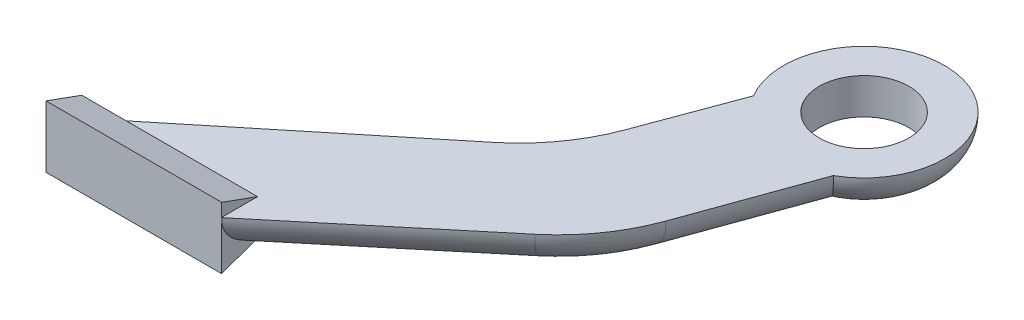
from build123d import *

# Parameters (mm, degrees)
SKETCH1_R                = 2.5
BOSS_EXTRUDE1_DEPTH      = 2
FILLET1_R                = 10
FILLET2_R                = 10
BOSS_EXTRUDE2_DEPTH      = 5.3
BOSS_EXTRUDE2_DEPTH_BACK = 4.5
FILLET7_R                = 2
FILLET8_R                = 2


with BuildPart() as part:
    # Sketch1 → Boss-Extrude1 (new body)
    with BuildSketch(Plane(origin=(0, 0, 0), x_dir=(1, 0, 0), z_dir=(0, 1, 0))):
        with BuildLine():
            Line((4.734439188, 4.337505525), (-11.123424173, -8.60036928))
            Line((-11.123424173, -8.60036928), (-1.31921636, -8.60036928))
            Line((-1.31921636, -8.60036928), (10.297086052, 1.061724594))
            Line((10.297086052, 1.061724594), (13.693514413, 10.480195617))
            ThreePointArc((13.693514413, 10.480195617), (12.643820806, 18.747230765), (7.611903427, 12.10452542))
            Line((7.611903427, 12.10452542), (4.734439188, 4.337505525))
        make_face()
        with Locations(Location((11.482625797, 14.39963072, 0), (0, 0, 270))):
            Circle(SKETCH1_R, mode=Mode.SUBTRACT)
    extrude(amount=BOSS_EXTRUDE1_DEPTH)

    # Fillet1
    fillet1_edges = [part.edges().sort_by_distance(p)[0] for p in [
        (10.297086052, 1, -1.061724594),
    ]]
    fillet(fillet1_edges, radius=FILLET1_R)

    # Fillet2
    fillet2_edges = [part.edges().sort_by_distance(p)[0] for p in [
        (4.734439188, 1, -4.337505525),
    ]]
    fillet(fillet2_edges, radius=FILLET2_R)

    # Sketch6 → Boss-Extrude2 (add, two sides: drawn at the far end of the back side and taken through both)
    with BuildSketch(Plane(origin=(-6.65, 0, 0), x_dir=(0, 0, -1), z_dir=(1, 0, 0)).offset(-BOSS_EXTRUDE2_DEPTH_BACK)):
        Polygon((-8.60036928, 2.725), (-6.60036928, 2), (-6.60036928, 0), (-8.60036928, -0.725), align=None)
    extrude(amount=BOSS_EXTRUDE2_DEPTH + BOSS_EXTRUDE2_DEPTH_BACK)

    # Fillet7
    fillet7_edges = [part.edges().sort_by_distance(p)[0] for p in [
        (6.646109692, 0, -9.497598443),
        (4.438286722, 0, -4.549211293),
        (-3.023640286, 0, 1.992039552),
        (12.456410034, 0, -7.049641368),
        (9.999920903, 0, -1.270100821),
        (3.443902415, 0, 4.638549149),
    ]]
    fillet(fillet7_edges, radius=FILLET7_R - 0.0001)  # a hair under: the kernel refuses the full size

    # Fillet8
    fillet8_edges = [part.edges().sort_by_distance(p)[0] for p in [
        (12.744313914, 0, -18.719137995),
    ]]
    fillet(fillet8_edges, radius=FILLET8_R - 0.0001)  # a hair under: the kernel refuses the full size


solid = part.part
